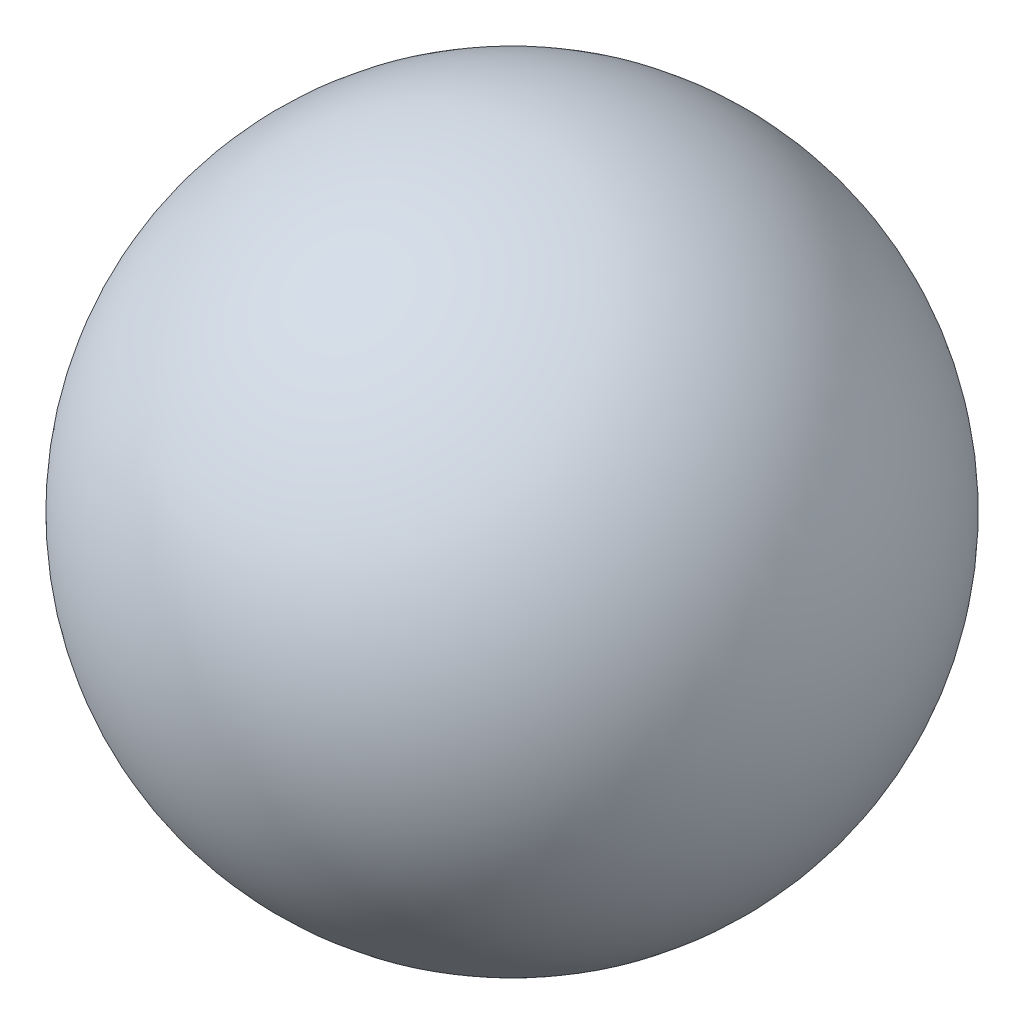
from build123d import *


with BuildPart() as part:
    # Sketch1 → Revolve2 (revolve)
    with BuildSketch(Plane.XY):
        with BuildLine():
            ThreePointArc((6.763932023, 2), (6, 0), (6.763932023, -2))
            ThreePointArc((6.763932023, -2), (7.775255129, -2.738612788), (9, -3))
            Line((9, -3), (9, 3))
            ThreePointArc((9, 3), (7.775255129, 2.738612788), (6.763932023, 2))
        make_face()
    revolve(axis=Axis((9, 3, 0), (0, -1, 0)))


solid = part.part
